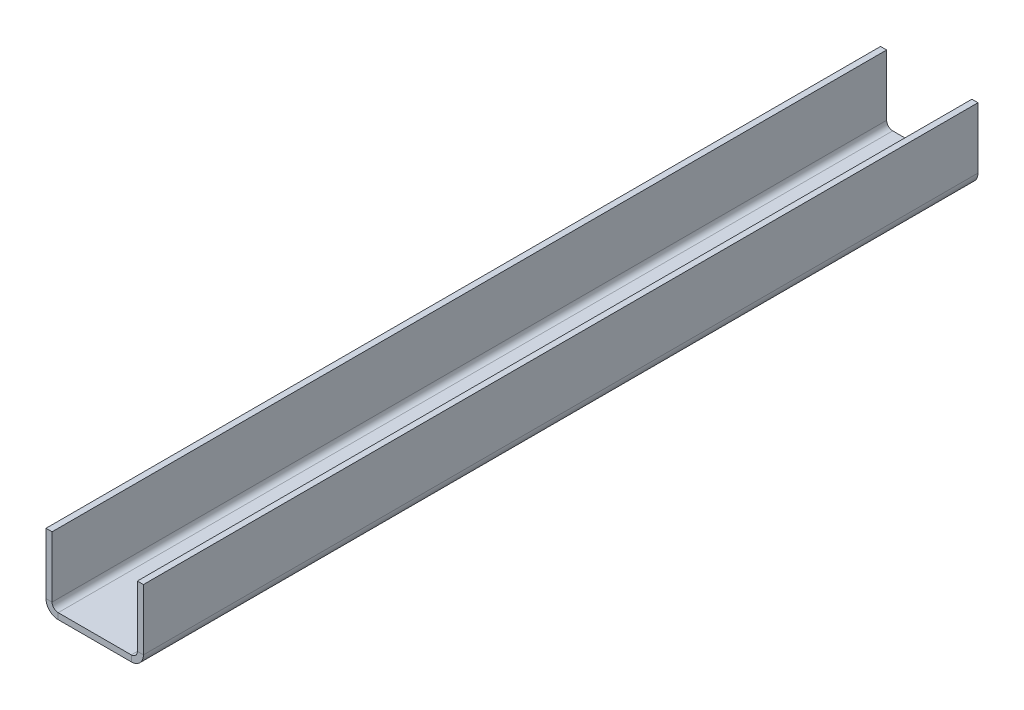
from build123d import *

# Parameters (mm, degrees)
BASE_FLANGE1_DEPTH = 434.975


# Sheet-metal steps are written as plain solids
with BuildPart() as part:
    # Sketch1 → Base-Flange1 (new body)
    with BuildSketch(Plane.XY):
        with BuildLine():
            Line((50.8, 38.1), (50.8, 6.35))
            ThreePointArc((50.8, 6.35), (48.940128061, 1.859871939), (44.45, 0))
            Line((44.45, 0), (6.35, 0))
            ThreePointArc((6.35, 0), (1.859871939, 1.859871939), (0, 6.35))
            Line((0, 6.35), (0, 38.1))
            Line((0, 38.1), (3.175, 38.1))
            Line((3.175, 38.1), (3.175, 6.35))
            ThreePointArc((3.175, 6.35), (4.10493597, 4.10493597), (6.35, 3.175))
            Line((6.35, 3.175), (44.45, 3.175))
            ThreePointArc((44.45, 3.175), (46.69506403, 4.10493597), (47.625, 6.35))
            Line((47.625, 6.35), (47.625, 38.1))
            Line((47.625, 38.1), (50.8, 38.1))
        make_face()
    extrude(amount=BASE_FLANGE1_DEPTH)


solid = part.part
